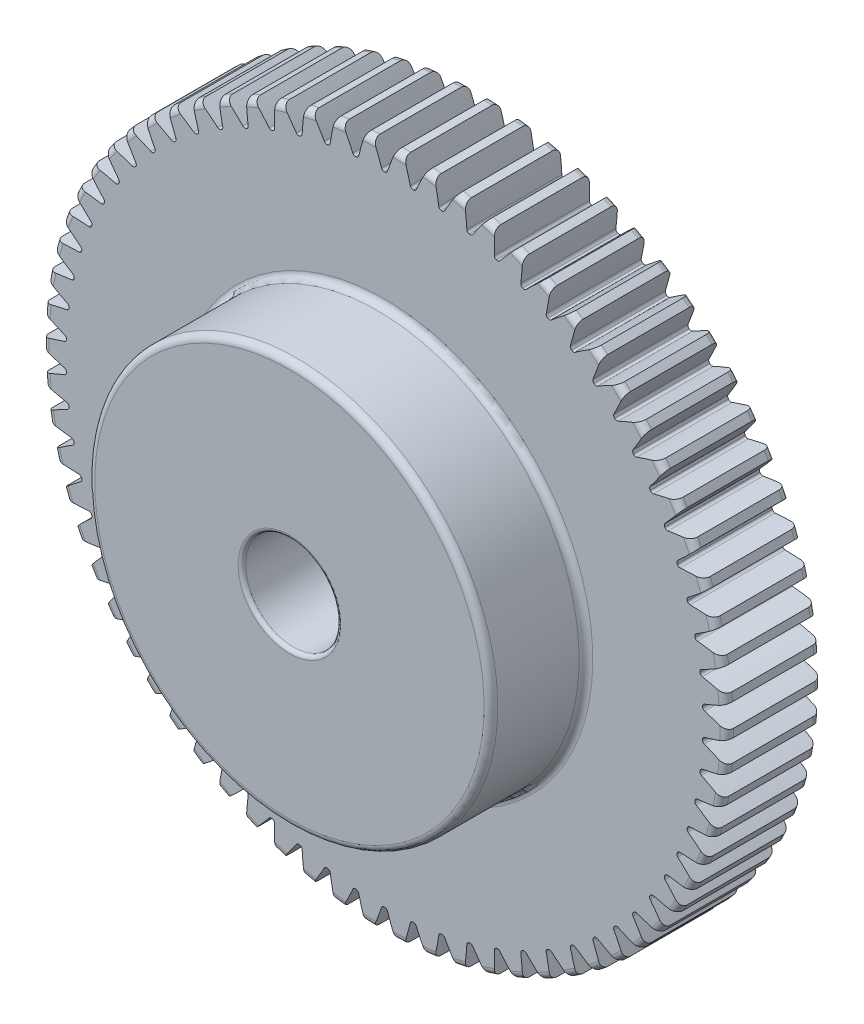
from build123d import *

# Parameters (mm, degrees)
FILLET2_R          = 0.9144
CUT_EXTRUDE2_DEPTH = 66.893298736
CIRPATTERN1_COUNT  = 70
FILLET3_R          = 0.508
SKETCH8_W          = 3.302
SKETCH8_H          = 3.302
CUT_EXTRUDE3_DEPTH = 12.7


with BuildPart() as part:
    # Sketch4 → Revolve1 (revolve)
    with BuildSketch(Plane(origin=(0, 0, 0), x_dir=(0, 0, -1), z_dir=(1, 0, 0))):
        Polygon((-25.4, 6.35), (-25.4, 26.924), (-12.7, 26.924), (-12.7, 45.72), (0, 45.72), (0, 6.35), align=None)
    revolve(axis=Axis((0, 0, 12.7), (0, 0, 1)))

    # Fillet2
    fillet2_edges = [part.edges().sort_by_distance(p)[0] for p in [
        (0, -26.924, 25.4),
        (0, -26.924, 12.7),
        (0, -45.72, 12.7),
        (0, -45.72, 0),
    ]]
    fillet(fillet2_edges, radius=FILLET2_R)

    # Sketch7 → Cut-Extrude2 (cut, through all)
    with BuildSketch(Plane.XY.offset(12.7)):
        with BuildLine():
            ThreePointArc((-0.035776995, 42.544984957), (0, 42.545), (0.035776995, 42.544984957))
            ThreePointArc((0.035776995, 42.544984957), (0.257128983, 42.615646356), (0.396284661, 42.80172546))
            ThreePointArc((0.396284661, 42.80172546), (0.927425025, 44.258110998), (1.50902682, 45.695089868))
            ThreePointArc((1.50902682, 45.695089868), (0, 45.72), (-1.50902682, 45.695089868))
            ThreePointArc((-1.50902682, 45.695089868), (-0.927425025, 44.258110998), (-0.396284661, 42.80172546))
            ThreePointArc((-0.396284661, 42.80172546), (-0.257128983, 42.615646356), (-0.035776995, 42.544984957))
        make_face()
    cut_extrude2 = extrude(amount=-CUT_EXTRUDE2_DEPTH, mode=Mode.SUBTRACT)

    # CirPattern1: Cut-Extrude2 ×70 about axis
    cirpattern1_axis = Axis((0, 0, 25.4), (0, 0, -1))
    for i in range(1, CIRPATTERN1_COUNT):
        add(cut_extrude2.rotate(cirpattern1_axis, i * 360 / CIRPATTERN1_COUNT), mode=Mode.SUBTRACT)

    # Fillet3
    fillet3_edges = [part.edges().sort_by_distance(p)[0] for p in [
        (0, -6.35, 0),
        (0, -6.35, 25.4),
    ]]
    fillet(fillet3_edges, radius=FILLET3_R)

    # Sketch8 → Cut-Extrude3 (cut)
    with BuildSketch(Plane(origin=(0, 0, 0), x_dir=(-1, 0, 0), z_dir=(0, 0, -1))):
        with Locations((0, 6.131614714)):
            Rectangle(SKETCH8_W, SKETCH8_H)
    extrude(amount=-CUT_EXTRUDE3_DEPTH, mode=Mode.SUBTRACT)


solid = part.part
